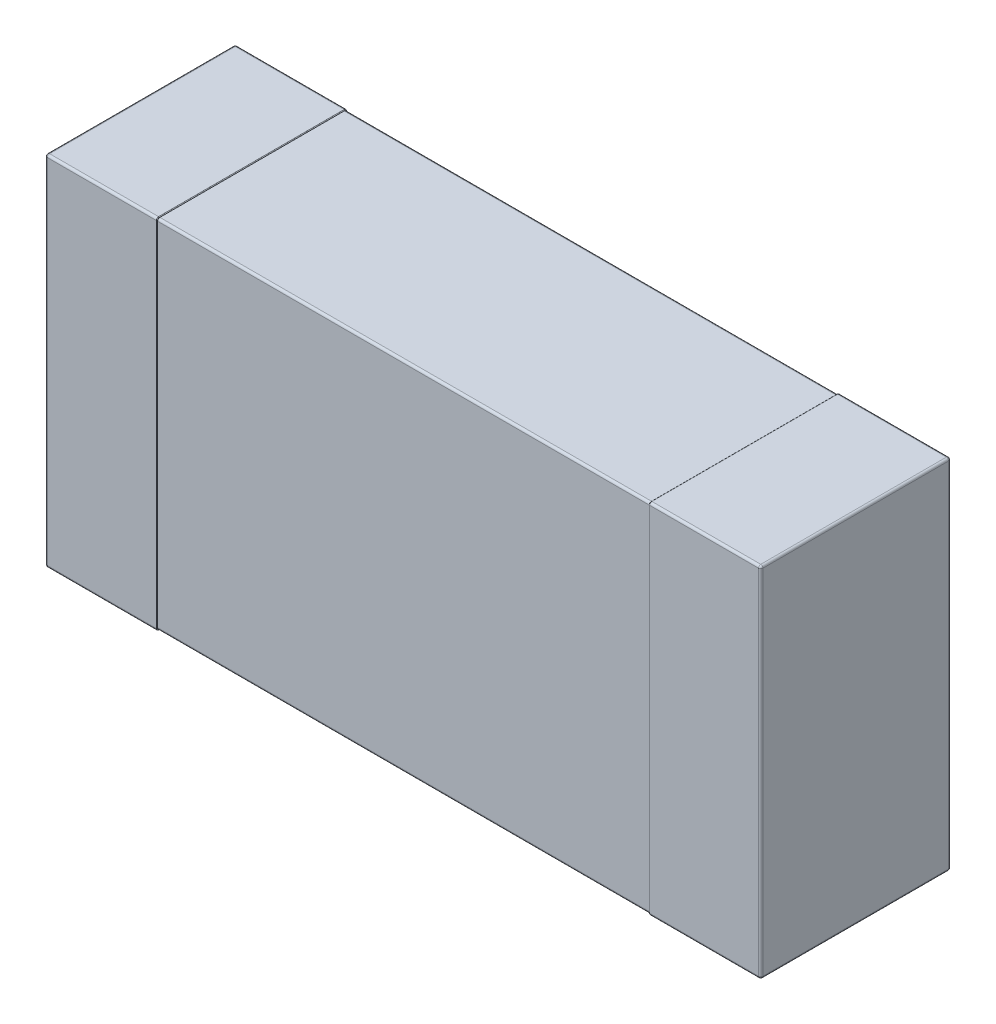
from build123d import *

# Parameters (mm, degrees)
SKETCH1_W                           = 3.2
SKETCH1_H                           = 1.6
ALL_BODY_DEPTH                      = 0.85
CUT_OUT_THE_BODY_FOR_PIN_DEPTH      = 1.1
CUT_OUT_THE_BODY_FOR_PIN_DEPTH_BACK = 1.1
SKETCH2_OUTSIDE_W                   = 3.586
SKETCH2_OUTSIDE_H                   = 4.336
SKETCH2_OUTSIDE_W_2                 = 0.844
SKETCH2_OUTSIDE_H_2                 = 1.594
BODY_FILLET_R                       = 0.01
PIN_FILLET_A_R                      = 0.01
PIN_FILLET_B_R                      = 0.003


with BuildPart() as part:
    # Sketch1 → All body (new body)
    with BuildSketch(Plane.XY):
        Rectangle(SKETCH1_W, SKETCH1_H)
    extrude(amount=ALL_BODY_DEPTH)

    # Sketch2 outside → Cut out the body for pin (cut, two sides: drawn at the far end of the back side and taken through both)
    with BuildSketch(Plane(origin=(0, 0, 0), x_dir=(0, 0, -1), z_dir=(1, 0, 0)).offset(-CUT_OUT_THE_BODY_FOR_PIN_DEPTH_BACK)):
        with Locations((-0.425, 0)):
            Rectangle(SKETCH2_OUTSIDE_W, SKETCH2_OUTSIDE_H)
        with Locations((-0.425, 0)):
            Rectangle(SKETCH2_OUTSIDE_W_2, SKETCH2_OUTSIDE_H_2, mode=Mode.SUBTRACT)
    extrude(amount=CUT_OUT_THE_BODY_FOR_PIN_DEPTH + CUT_OUT_THE_BODY_FOR_PIN_DEPTH_BACK, mode=Mode.SUBTRACT)

    # Body fillet
    body_fillet_edges = [part.edges().sort_by_distance(p)[0] for p in [
        (0, 0.797, 0.003),
        (0, 0.797, 0.847),
        (0, -0.797, 0.847),
        (0, -0.797, 0.003),
    ]]
    fillet(body_fillet_edges, radius=BODY_FILLET_R)

    # Pin fillet a
    pin_fillet_a_edges = [part.edges().sort_by_distance(p)[0] for p in [
        (1.6, 0, 0.85),
        (-1.35, 0.8, 0),
        (1.35, -0.8, 0),
        (1.35, -0.8, 0.85),
        (-1.35, 0.8, 0.85),
        (1.35, 0.8, 0.85),
        (-1.6, 0, 0.85),
        (1.35, 0.8, 0),
        (1.6, 0, 0),
        (-1.35, -0.8, 0),
        (-1.6, 0, 0),
        (-1.6, 0.8, 0.425),
        (1.6, 0.8, 0.425),
        (1.6, -0.8, 0.425),
        (-1.6, -0.8, 0.425),
        (-1.35, -0.8, 0.85),
    ]]
    fillet(pin_fillet_a_edges, radius=PIN_FILLET_A_R)

    # Pin fillet b
    pin_fillet_b_edges = [part.edges().sort_by_distance(p)[0] for p in [
        (1.1, -0.8, 0.425),
        (1.1, 0, 0.85),
        (1.1, 0.8, 0.425),
        (1.1, 0, 0),
        (-1.1, 0.8, 0.425),
        (-1.1, 0, 0.85),
        (-1.1, -0.8, 0.425),
        (-1.1, 0, 0),
        (1.1, 0.797071068, 0.002928932),
        (1.1, -0.797071068, 0.002928932),
        (1.1, -0.797071068, 0.847071068),
        (1.1, 0.797071068, 0.847071068),
        (-1.1, -0.797071068, 0.847071068),
        (-1.1, 0.797071068, 0.847071068),
        (-1.1, -0.797071068, 0.002928932),
        (-1.1, 0.797071068, 0.002928932),
    ]]
    fillet(pin_fillet_b_edges, radius=PIN_FILLET_B_R - 0.0001)  # a hair under: the kernel refuses the full size


solid = part.part
